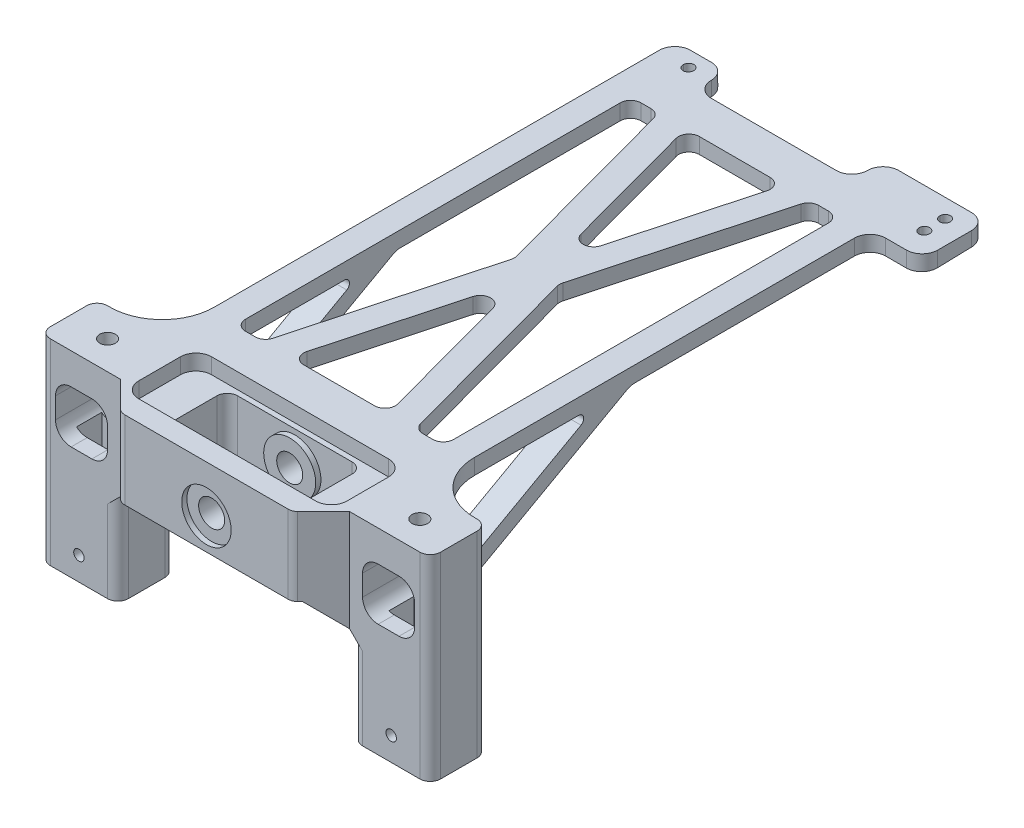
from build123d import *
from OCP.BRepAlgoAPI import BRepAlgoAPI_Cut
from OCP.TopTools import TopTools_ListOfShape

# Parameters (mm, degrees)
EXTRUDE_1_DEPTH        = 5.5
EXTRUDE_1_DEPTH_BACK   = 5.5
EXTRUDE_1_2_DEPTH      = 5.5
EXTRUDE_1_2_DEPTH_BACK = 5.5
SKETCH_2_W             = 7.050000000000001
SKETCH_2_H             = 4.83
CUT_EXTRUDE_1_DEPTH    = 62.00000000000001
SKETCH_3_W             = 26.000000000000004
SKETCH_3_H             = 12
EXTRUDE_2_DEPTH        = 12
SKETCH_4_R             = 2.5000000000000013
CUT_EXTRUDE_2_DEPTH    = 90
CHAMFER_2_SIZE         = 5
FILLET_2_R             = 2
SKETCH_14_W            = 15
SKETCH_14_H            = 11
EXTRUDE_5_DEPTH        = 10.25
SKETCH_7_R             = 0.9999999999999983
SKETCH_7_R_2           = 1.0000000000000018
CUT_EXTRUDE_3_DEPTH    = 34
EXTRUDE_START          = 1
SKETCH_13_R            = 5.0000000000000036
SKETCH_13_R_2          = 2.5000000000000013
EXTRUDE_4_DEPTH        = 1
CHAMFER_3_SIZE         = 5
CUT_EXTRUDE_4_DEPTH    = 31.2
SKETCH_17_R            = 4.75
SKETCH_17_R_2          = 2.5000000000000018
CUT_EXTRUDE_5_DEPTH    = 1
EXTRUDE_6_DEPTH        = 4.83
FILLET_6_R             = 3
FILLET_7_R             = 2
SKETCH_23_R            = 1.500000000000004
SKETCH_23_R_2          = 1.5000000000000007
CUT_EXTRUDE_6_DEPTH    = 3
EXTRUDE_START_2        = 3
SKETCH_24_R            = 1.499999999999997
SKETCH_24_W            = 39.99999999999999
SKETCH_24_H            = 14.000000000000002
SKETCH_24_R_2          = 1.500000000000004
SKETCH_24_R_3          = 1.0000000000000018
SKETCH_24_R_4          = 0.9999999999999983
EXTRUDE_7_DEPTH        = 3
FILLET_8_R             = 3
CUT_EXTRUDE_7_DEPTH    = 10
FILLET_10_R            = 10
FILLET_11_R            = 2
FILLET_12_R            = 3
CUT_EXTRUDE_8_DEPTH    = 67.00000000000001
SKETCH_31_RX           = 1.0003427924908692
SKETCH_31_RY           = 1.0000000000000009
SKETCH_31_RX_2         = 1.0003427924908834
CUT_EXTRUDE_9_DEPTH    = 67.00000000000001
EXTRUDE_11_REACH       = 117.887
CUT_EXTRUDE_11_DEPTH   = 15.000000000000004
FILLET_13_R            = 1
CUT_EXTRUDE_12_REACH   = 125.404
FILLET_14_R            = 3
EXTRUDE_12_REACH       = 117.887
SKETCH_38_W            = 4.999999999999954
SKETCH_38_H            = 40
CUT_EXTRUDE_13_DEPTH   = 15.000000000000004
FILLET_15_R            = 1
CUT_EXTRUDE_14_REACH   = 125.404
FILLET_16_R            = 3
FILLET_17_R            = 3
FILLET_18_R            = 1
SKETCH_41_W            = 30.000000000000004
SKETCH_41_H            = 6.000000000000028
CUT_EXTRUDE_15_DEPTH   = 3
FILLET_19_R            = 3


# Some blends are built 0.0001 mm under size
with BuildPart() as part:
    # 草图1 → 凸台-拉伸1 (new, two sides: drawn at the far end of the back side and taken through both)
    with BuildSketch(Plane.XY.offset(-EXTRUDE_1_DEPTH_BACK)):
        Polygon((22.5, -12.250000000000004), (37.5, -12.250000000000002), (37.5, 12.25), (22.5, 12.249999999999996), align=None)
    extrude(amount=EXTRUDE_1_DEPTH + EXTRUDE_1_DEPTH_BACK)


with BuildPart() as body_2:
    # 草图1 → Extrude 1 2 (new, two sides: drawn at the far end of the back side and taken through both)
    with BuildSketch(Plane.XY.offset(-EXTRUDE_1_2_DEPTH_BACK)):
        Polygon((-37.5, -12.250000000000002), (-37.5, 12.25), (-22.5, 12.249999999999996), (-22.5, -12.250000000000004), align=None)
    extrude(amount=EXTRUDE_1_2_DEPTH + EXTRUDE_1_2_DEPTH_BACK)


with BuildPart() as cut_extrude_1_tool:
    # 草图2 → 切除-拉伸1 (new body)
    with BuildSketch(Plane(origin=(-2.83e-15, 12.249999999999991, 0), x_dir=(1, -4.6e-16, 0), z_dir=(4.6e-16, 1, 0))):
        with Locations((30, 8.9e-16)):
            Rectangle(SKETCH_2_W, SKETCH_2_H)
        with Locations((-30, 8.9e-16)):
            Rectangle(SKETCH_2_W, SKETCH_2_H)
    extrude(amount=-CUT_EXTRUDE_1_DEPTH)


with BuildPart() as part_1:
    add(part.part)

    # 切除-拉伸1: cut by cut_extrude_1_tool
    add(cut_extrude_1_tool.part, mode=Mode.SUBTRACT)



with BuildPart() as body_2_1:
    add(body_2.part)

    # 切除-拉伸1: cut by cut_extrude_1_tool
    add(cut_extrude_1_tool.part, mode=Mode.SUBTRACT)


with BuildPart() as part_2:
    add(part_1.part)

    add(body_2_1.part)  # 凸台-拉伸2 merges body 2
    # 草图3 → 凸台-拉伸2 (add)
    with BuildSketch(Plane(origin=(2.83e-15, 12.249999999999991, 0), x_dir=(1, -2.3e-16, 0), z_dir=(2.3e-16, 1, 0))):
        Polygon((22.500000000000004, 5.5), (17, 5.499999999999999), (17, 11), (-17, 11), (-17, 5.499999999999999), (-22.500000000000004, 5.5), (-22.500000000000004, -5.5), (-17, -5.499999999999999), (-17, -11), (17, -11), (17, -5.499999999999999), (22.500000000000004, -5.5), align=None)
        Rectangle(SKETCH_3_W, SKETCH_3_H, mode=Mode.SUBTRACT)
    extrude(amount=-EXTRUDE_2_DEPTH)

    # 草图4 → 切除-拉伸2 (cut)
    with BuildSketch(Plane.XY.offset(11)):
        with Locations((0, 6.249999999999996)):
            Circle(SKETCH_4_R)
    extrude(amount=-CUT_EXTRUDE_2_DEPTH, mode=Mode.SUBTRACT)

    # 倒角2
    chamfer_2_edges = [part_2.edges().sort_by_distance(p)[0] for p in [
        (17.000000000000004, 6.249999999999988, 5.499999999999999),
        (-16.999999999999996, 6.249999999999995, 5.499999999999999),
        (-16.999999999999996, 6.249999999999995, -5.499999999999999),
        (17.000000000000004, 6.249999999999988, -5.499999999999999),
    ]]
    chamfer(chamfer_2_edges, length=CHAMFER_2_SIZE)

    # 圆角2
    # the kernel refuses this fillet: 2 mm, written as the material it adds along each edge
    with BuildSketch(Plane(origin=(-12.999999999999996, 12.249999999999995, 6), x_dir=(0, 0, -1), z_dir=(-2.3e-16, -1, 0)), Plane(origin=(13.000000000000004, 12.249999999999988, -6), x_dir=(0, 0, 1), z_dir=(-2.3e-16, -1, 0))) as fillet_2_piece_1:
        with BuildLine():
            CenterArc((FILLET_2_R, FILLET_2_R), FILLET_2_R, 180, 90)
            Line((0, FILLET_2_R), (0, 0))
            Line((0, 0), (FILLET_2_R, 0))
        make_face()
    extrude(amount=12)
    with BuildSketch(Plane(origin=(13.000000000000004, 12.249999999999988, 6), x_dir=(-1, 2.3e-16, 0), z_dir=(-2.3e-16, -1, 0))) as fillet_2_piece_2:
        with BuildLine():
            CenterArc((FILLET_2_R, FILLET_2_R), FILLET_2_R, 180, 90)
            Line((0, FILLET_2_R), (0, 0))
            Line((0, 0), (FILLET_2_R, 0))
        make_face()
    extrude(amount=12)
    with BuildSketch(Plane(origin=(-12.999999999999996, 12.249999999999995, -6), x_dir=(0, 0, 1), z_dir=(-2.3e-16, -1, 0))) as fillet_2_piece_3:
        with BuildLine():
            CenterArc((FILLET_2_R, -FILLET_2_R), FILLET_2_R, 90, 90)
            Line((0, -FILLET_2_R), (0, 0))
            Line((0, 0), (FILLET_2_R, 0))
        make_face()
    extrude(amount=12)
    # the kernel refuses this fillet: 2 mm, written as the material it takes off along each edge
    with BuildSketch(Plane(origin=(17.000000000000004, 15.557189138830744, 11), x_dir=(-7.11e-15, 0, -1), z_dir=(-2.3e-16, -1, 0))) as fillet_2_2_piece_1:
        with BuildLine():
            CenterArc((2.0000000000000093, -1.3228756555322878), FILLET_2_R, 138.59037789072946, 41.40962210927091)
            Line((9.4e-15, -1.322875655532302), (0, 0))
            Line((0, 0), (0.5000000000000018, 0))
        make_face()
    extrude(amount=18.61437827766151, mode=Mode.SUBTRACT)
    with BuildSketch(Plane(origin=(-16.999999999999996, 15.557189138830733, 11), x_dir=(1, -2.3e-16, 0), z_dir=(-2.3e-16, -1, 0))) as fillet_2_2_piece_2:
        with BuildLine():
            CenterArc((1.322875655532295, -2), FILLET_2_R, 90, 41.409622109270856)
            Line((0, -0.5), (0, 0))
            Line((0, 0), (1.322875655532295, 0))
        make_face()
    extrude(amount=18.614378277661476, mode=Mode.SUBTRACT)
    with BuildSketch(Plane(origin=(-16.999999999999996, 15.55718913883074, -11), x_dir=(1, -2.3e-16, 0), z_dir=(-2.3e-16, -1, 0))) as fillet_2_2_piece_3:
        with BuildLine():
            CenterArc((1.3228756555322985, 2), FILLET_2_R, 228.59037789072903, 41.40962210927097)
            Line((0, 0.5000000000000018), (0, 0))
            Line((0, 0), (1.3228756555322985, 0))
        make_face()
    extrude(amount=18.614378277661494, mode=Mode.SUBTRACT)
    with BuildSketch(Plane(origin=(17.000000000000004, 15.557189138830738, -11), x_dir=(-7.11e-15, 0, 1), z_dir=(-2.3e-16, -1, 0))) as fillet_2_2_piece_4:
        with BuildLine():
            CenterArc((2.0000000000000093, 1.322875655532286), FILLET_2_R, 179.9999999999996, 41.40962210927091)
            Line((9.4e-15, 1.3228756555323002), (0, 0))
            Line((0, 0), (0.5, 0))
        make_face()
    extrude(amount=18.6143782776615, mode=Mode.SUBTRACT)

    # 草图14 → 凸台-拉伸5 (add)
    # profile 1 of 2: a face of its own
    with BuildSketch(Plane.XZ.offset(12.250000000000007)):
        with Locations((-30, 0)):
            Rectangle(SKETCH_14_W, SKETCH_14_H)
        Polygon((-26.47500000000001, -2.415000000000001), (-26.47500000000001, 2.414999999999999), (-33.52500000000001, 2.414999999999999), (-33.52500000000003, -2.415000000000001), align=None, mode=Mode.SUBTRACT)
    # profile 2 of 2: a face of its own
    with BuildSketch(Plane.XZ.offset(12.250000000000007)):
        with Locations((30, 0)):
            Rectangle(SKETCH_14_W, SKETCH_14_H)
        Polygon((26.47499999999998, 2.414999999999999), (26.474999999999962, -2.415000000000001), (33.52499999999999, -2.415000000000001), (33.52499999999999, 2.414999999999999), align=None, mode=Mode.SUBTRACT)
    extrude(amount=EXTRUDE_5_DEPTH)

    # 草图7 → 切除-拉伸3 (cut)
    with BuildSketch(Plane.XY.offset(5.4999999999999964)):
        with Locations(Location((30, -18, 0), (0, 0, 180))):
            Circle(SKETCH_7_R)
        with Locations(Location((-30, -18, 0), (0, 0, 180))):
            Circle(SKETCH_7_R_2)
    extrude(amount=-CUT_EXTRUDE_3_DEPTH, mode=Mode.SUBTRACT)

    # 草图13 → 凸台-拉伸4 (add)
    with BuildSketch(Plane.XY.offset(-6).offset(EXTRUDE_START)):
        with Locations(Location((0, 6.249999999999996, 0), (0, 0, 180))):
            Circle(SKETCH_13_R)
        with Locations((0, 6.249999999999996)):
            Circle(SKETCH_13_R_2, mode=Mode.SUBTRACT)
    extrude_4 = extrude(amount=-EXTRUDE_4_DEPTH)

    # 镜向1: 凸台-拉伸4 across plane
    add(extrude_4.mirror(Plane.XY))

    # 倒角3
    chamfer_3_edges = [part_2.edges().sort_by_distance(p)[0] for p in [
        (22.500000000000004, 0.2499999999999859, 0),
        (-22.500000000000004, 0.24999999999999634, 0),
    ]]
    chamfer(chamfer_3_edges, length=CHAMFER_3_SIZE)

    # 草图19 → 切除-拉伸4 (cut)
    with BuildSketch(Plane.XY.offset(5.4999999999999964)):
        Polygon((-34.49999999999999, -0.7499999999999989), (-24.499999999999993, -0.7499999999999989), (-24.499999999999993, 9.25), (-34.49999999999999, 9.250000000000002), align=None)
        Polygon((34.49999999999999, 9.250000000000002), (24.499999999999993, 9.25), (24.499999999999993, -0.7499999999999989), (34.49999999999999, -0.7499999999999989), align=None)
    extrude(amount=-CUT_EXTRUDE_4_DEPTH, mode=Mode.SUBTRACT)

    # 草图17 → 切除-拉伸5 (cut)
    with BuildSketch(Plane.XY.offset(11)):
        with Locations((0, 6.249999999999996)):
            Circle(SKETCH_17_R)
        with Locations((0, 6.249999999999996)):
            Circle(SKETCH_17_R_2, mode=Mode.SUBTRACT)
    cut_extrude_5 = extrude(amount=-CUT_EXTRUDE_5_DEPTH, mode=Mode.SUBTRACT)

    # 镜向2: 切除-拉伸5 across plane
    add(cut_extrude_5.mirror(Plane.XY), mode=Mode.SUBTRACT)

    # 草图20 → 凸台-拉伸6 (add)
    with BuildSketch(Plane.XY.offset(-2.415000000000001)):
        Polygon((-33.525, 12.250000000000007), (-33.52500000000003, 9.250000000000004), (-26.474999999999998, 9.250000000000002), (-26.474999999999998, 12.249999999999998), align=None)
        Polygon((33.525, 9.250000000000002), (33.525, 12.249999999999998), (26.47499999999999, 12.24999999999998), (26.474999999999962, 9.250000000000002), align=None)
    extrude(amount=EXTRUDE_6_DEPTH)

    # 圆角6
    # the kernel refuses this fillet: 3 mm, written as the material it adds along each edge
    with BuildSketch(Plane(origin=(24.499999999999993, -0.7499999999999989, 5.4999999999999964), x_dir=(0, 1, 0), z_dir=(0, 0, -1))) as fillet_6_piece_1_section:
        with BuildLine():
            CenterArc((FILLET_6_R, FILLET_6_R), FILLET_6_R, 180, 90)
            Line((-2.2e-16, FILLET_6_R), (0, 0))
            Line((0, 0), (FILLET_6_R, 0))
        make_face()
    fillet_6_piece_1 = extrude(amount=10.999999999999996, mode=Mode.PRIVATE)
    fillet_6_piece_1 = split(fillet_6_piece_1, bisect_by=Plane(origin=(24.499999999999993, -0.7499999999999989, 2.414999999999999), z_dir=(0, 0, 1)), keep=Keep.TOP, mode=Mode.PRIVATE)
    fillet_6_piece_1 = split(fillet_6_piece_1, bisect_by=Plane(origin=(26.474999999999984, -0.7499999999999998, 5.4999999999999964), z_dir=(-1, 4.6e-16, 0)), keep=Keep.TOP, mode=Mode.PRIVATE)
    add(fillet_6_piece_1)
    with BuildSketch(Plane(origin=(24.499999999999993, -0.7499999999999989, 5.4999999999999964), x_dir=(0, 1, 0), z_dir=(0, 0, -1))) as fillet_6_piece_2_section:
        with BuildLine():
            CenterArc((FILLET_6_R, FILLET_6_R), FILLET_6_R, 180, 90)
            Line((-2.2e-16, FILLET_6_R), (0, 0))
            Line((0, 0), (FILLET_6_R, 0))
        make_face()
    fillet_6_piece_2 = extrude(amount=10.999999999999996, mode=Mode.PRIVATE)
    fillet_6_piece_2 = split(fillet_6_piece_2, bisect_by=Plane(origin=(24.499999999999993, -0.7499999999999989, 2.414999999999999), z_dir=(0, 0, 1)), keep=Keep.TOP, mode=Mode.PRIVATE)
    fillet_6_piece_2 = split(fillet_6_piece_2, bisect_by=Plane(origin=(26.474999999999984, -0.7499999999999998, 5.4999999999999964), z_dir=(1, -4.6e-16, 0)), keep=Keep.TOP, mode=Mode.PRIVATE)
    add(fillet_6_piece_2)
    with BuildSketch(Plane(origin=(24.499999999999993, -0.7499999999999989, 5.4999999999999964), x_dir=(0, 1, 0), z_dir=(0, 0, -1))) as fillet_6_piece_3_section:
        with BuildLine():
            CenterArc((FILLET_6_R, FILLET_6_R), FILLET_6_R, 180, 90)
            Line((-2.2e-16, FILLET_6_R), (0, 0))
            Line((0, 0), (FILLET_6_R, 0))
        make_face()
    fillet_6_piece_3 = extrude(amount=10.999999999999996, mode=Mode.PRIVATE)
    fillet_6_piece_3 = split(fillet_6_piece_3, bisect_by=Plane(origin=(24.499999999999993, -0.7499999999999989, -2.415000000000001), z_dir=(0, 0, 1)), keep=Keep.TOP, mode=Mode.PRIVATE)
    fillet_6_piece_3 = split(fillet_6_piece_3, bisect_by=Plane(origin=(24.499999999999993, -0.7499999999999989, 2.414999999999999), z_dir=(0, 0, -1)), keep=Keep.TOP, mode=Mode.PRIVATE)
    fillet_6_piece_3 = split(fillet_6_piece_3, bisect_by=Plane(origin=(26.474999999999984, -0.7499999999999998, 5.4999999999999964), z_dir=(-1, 4.6e-16, 0)), keep=Keep.TOP, mode=Mode.PRIVATE)
    add(fillet_6_piece_3)
    with BuildSketch(Plane(origin=(24.499999999999993, -0.7499999999999989, 5.4999999999999964), x_dir=(0, 1, 0), z_dir=(0, 0, -1))) as fillet_6_piece_4_section:
        with BuildLine():
            CenterArc((FILLET_6_R, FILLET_6_R), FILLET_6_R, 180, 90)
            Line((-2.2e-16, FILLET_6_R), (0, 0))
            Line((0, 0), (FILLET_6_R, 0))
        make_face()
    fillet_6_piece_4 = extrude(amount=10.999999999999996, mode=Mode.PRIVATE)
    fillet_6_piece_4 = split(fillet_6_piece_4, bisect_by=Plane(origin=(24.499999999999993, -0.7499999999999989, -2.415000000000001), z_dir=(0, 0, -1)), keep=Keep.TOP, mode=Mode.PRIVATE)
    fillet_6_piece_4 = split(fillet_6_piece_4, bisect_by=Plane(origin=(26.474999999999984, -0.7499999999999998, 5.4999999999999964), z_dir=(-1, 4.6e-16, 0)), keep=Keep.TOP, mode=Mode.PRIVATE)
    add(fillet_6_piece_4)
    with BuildSketch(Plane(origin=(24.499999999999993, -0.7499999999999989, 5.4999999999999964), x_dir=(0, 1, 0), z_dir=(0, 0, -1))) as fillet_6_piece_5_section:
        with BuildLine():
            CenterArc((FILLET_6_R, FILLET_6_R), FILLET_6_R, 180, 90)
            Line((-2.2e-16, FILLET_6_R), (0, 0))
            Line((0, 0), (FILLET_6_R, 0))
        make_face()
    fillet_6_piece_5 = extrude(amount=10.999999999999996, mode=Mode.PRIVATE)
    fillet_6_piece_5 = split(fillet_6_piece_5, bisect_by=Plane(origin=(24.499999999999993, -0.7499999999999989, -2.415000000000001), z_dir=(0, 0, -1)), keep=Keep.TOP, mode=Mode.PRIVATE)
    fillet_6_piece_5 = split(fillet_6_piece_5, bisect_by=Plane(origin=(26.474999999999984, -0.7499999999999998, 5.4999999999999964), z_dir=(1, -4.6e-16, 0)), keep=Keep.TOP, mode=Mode.PRIVATE)
    add(fillet_6_piece_5)
    with BuildSketch(Plane(origin=(-24.499999999999993, -0.7499999999999989, 5.4999999999999964), x_dir=(-1, -7e-17, 0), z_dir=(0, 0, -1))) as fillet_6_piece_6_section:
        with BuildLine():
            CenterArc((FILLET_6_R, FILLET_6_R), FILLET_6_R, 180, 90)
            Line((-2.2e-16, FILLET_6_R), (0, 0))
            Line((0, 0), (FILLET_6_R, 0))
        make_face()
    fillet_6_piece_6 = extrude(amount=10.999999999999996, mode=Mode.PRIVATE)
    fillet_6_piece_6 = split(fillet_6_piece_6, bisect_by=Plane(origin=(-24.499999999999993, -0.7499999999999989, 2.414999999999999), z_dir=(0, 0, 1)), keep=Keep.TOP, mode=Mode.PRIVATE)
    fillet_6_piece_6 = split(fillet_6_piece_6, bisect_by=Plane(origin=(-26.475000000000005, -0.749999999999998, 5.4999999999999964), z_dir=(-1, 4.6e-16, 0)), keep=Keep.TOP, mode=Mode.PRIVATE)
    add(fillet_6_piece_6)
    with BuildSketch(Plane(origin=(-24.499999999999993, -0.7499999999999989, 5.4999999999999964), x_dir=(-1, -7e-17, 0), z_dir=(0, 0, -1))) as fillet_6_piece_7_section:
        with BuildLine():
            CenterArc((FILLET_6_R, FILLET_6_R), FILLET_6_R, 180, 90)
            Line((-2.2e-16, FILLET_6_R), (0, 0))
            Line((0, 0), (FILLET_6_R, 0))
        make_face()
    fillet_6_piece_7 = extrude(amount=10.999999999999996, mode=Mode.PRIVATE)
    fillet_6_piece_7 = split(fillet_6_piece_7, bisect_by=Plane(origin=(-24.499999999999993, -0.7499999999999989, 2.414999999999999), z_dir=(0, 0, 1)), keep=Keep.TOP, mode=Mode.PRIVATE)
    fillet_6_piece_7 = split(fillet_6_piece_7, bisect_by=Plane(origin=(-26.475000000000005, -0.749999999999998, 5.4999999999999964), z_dir=(1, -4.6e-16, 0)), keep=Keep.TOP, mode=Mode.PRIVATE)
    add(fillet_6_piece_7)
    with BuildSketch(Plane(origin=(-24.499999999999993, -0.7499999999999989, 5.4999999999999964), x_dir=(-1, -7e-17, 0), z_dir=(0, 0, -1))) as fillet_6_piece_8_section:
        with BuildLine():
            CenterArc((FILLET_6_R, FILLET_6_R), FILLET_6_R, 180, 90)
            Line((-2.2e-16, FILLET_6_R), (0, 0))
            Line((0, 0), (FILLET_6_R, 0))
        make_face()
    fillet_6_piece_8 = extrude(amount=10.999999999999996, mode=Mode.PRIVATE)
    fillet_6_piece_8 = split(fillet_6_piece_8, bisect_by=Plane(origin=(-24.499999999999993, -0.7499999999999989, 2.414999999999999), z_dir=(0, 0, -1)), keep=Keep.TOP, mode=Mode.PRIVATE)
    fillet_6_piece_8 = split(fillet_6_piece_8, bisect_by=Plane(origin=(-24.499999999999993, -0.7499999999999989, -2.415000000000001), z_dir=(0, 0, 1)), keep=Keep.TOP, mode=Mode.PRIVATE)
    fillet_6_piece_8 = split(fillet_6_piece_8, bisect_by=Plane(origin=(-26.475000000000005, -0.749999999999998, 5.4999999999999964), z_dir=(1, -4.6e-16, 0)), keep=Keep.TOP, mode=Mode.PRIVATE)
    add(fillet_6_piece_8)
    with BuildSketch(Plane(origin=(-24.499999999999993, -0.7499999999999989, 5.4999999999999964), x_dir=(-1, -7e-17, 0), z_dir=(0, 0, -1))) as fillet_6_piece_9_section:
        with BuildLine():
            CenterArc((FILLET_6_R, FILLET_6_R), FILLET_6_R, 180, 90)
            Line((-2.2e-16, FILLET_6_R), (0, 0))
            Line((0, 0), (FILLET_6_R, 0))
        make_face()
    fillet_6_piece_9 = extrude(amount=10.999999999999996, mode=Mode.PRIVATE)
    fillet_6_piece_9 = split(fillet_6_piece_9, bisect_by=Plane(origin=(-24.499999999999993, -0.7499999999999989, -2.415000000000001), z_dir=(0, 0, -1)), keep=Keep.TOP, mode=Mode.PRIVATE)
    fillet_6_piece_9 = split(fillet_6_piece_9, bisect_by=Plane(origin=(-26.475000000000005, -0.749999999999998, 5.4999999999999964), z_dir=(-1, 4.6e-16, 0)), keep=Keep.TOP, mode=Mode.PRIVATE)
    add(fillet_6_piece_9)
    with BuildSketch(Plane(origin=(-24.499999999999993, -0.7499999999999989, 5.4999999999999964), x_dir=(-1, -7e-17, 0), z_dir=(0, 0, -1))) as fillet_6_piece_10_section:
        with BuildLine():
            CenterArc((FILLET_6_R, FILLET_6_R), FILLET_6_R, 180, 90)
            Line((-2.2e-16, FILLET_6_R), (0, 0))
            Line((0, 0), (FILLET_6_R, 0))
        make_face()
    fillet_6_piece_10 = extrude(amount=10.999999999999996, mode=Mode.PRIVATE)
    fillet_6_piece_10 = split(fillet_6_piece_10, bisect_by=Plane(origin=(-24.499999999999993, -0.7499999999999989, -2.415000000000001), z_dir=(0, 0, -1)), keep=Keep.TOP, mode=Mode.PRIVATE)
    fillet_6_piece_10 = split(fillet_6_piece_10, bisect_by=Plane(origin=(-26.475000000000005, -0.749999999999998, 5.4999999999999964), z_dir=(1, -4.6e-16, 0)), keep=Keep.TOP, mode=Mode.PRIVATE)
    add(fillet_6_piece_10)
    with BuildSketch(Plane(origin=(34.49999999999999, -0.7499999999999989, 5.4999999999999964), x_dir=(-1, -7e-17, 0), z_dir=(0, 0, -1))) as fillet_6_piece_11_section:
        with BuildLine():
            CenterArc((FILLET_6_R, FILLET_6_R), FILLET_6_R, 180, 90)
            Line((-2.2e-16, FILLET_6_R), (0, 0))
            Line((0, 0), (FILLET_6_R, 0))
        make_face()
    fillet_6_piece_11 = extrude(amount=10.999999999999996, mode=Mode.PRIVATE)
    fillet_6_piece_11 = split(fillet_6_piece_11, bisect_by=Plane(origin=(33.52499999999999, -0.7499999999999984, 5.4999999999999964), z_dir=(-1, 4.6e-16, 0)), keep=Keep.TOP, mode=Mode.PRIVATE)
    fillet_6_piece_11 = split(fillet_6_piece_11, bisect_by=Plane(origin=(34.49999999999999, -0.7499999999999989, 2.414999999999999), z_dir=(0, 0, 1)), keep=Keep.TOP, mode=Mode.PRIVATE)
    add(fillet_6_piece_11)
    with BuildSketch(Plane(origin=(34.49999999999999, -0.7499999999999989, 5.4999999999999964), x_dir=(-1, -7e-17, 0), z_dir=(0, 0, -1))) as fillet_6_piece_12_section:
        with BuildLine():
            CenterArc((FILLET_6_R, FILLET_6_R), FILLET_6_R, 180, 90)
            Line((-2.2e-16, FILLET_6_R), (0, 0))
            Line((0, 0), (FILLET_6_R, 0))
        make_face()
    fillet_6_piece_12 = extrude(amount=10.999999999999996, mode=Mode.PRIVATE)
    fillet_6_piece_12 = split(fillet_6_piece_12, bisect_by=Plane(origin=(33.52499999999999, -0.7499999999999984, 5.4999999999999964), z_dir=(1, -4.6e-16, 0)), keep=Keep.TOP, mode=Mode.PRIVATE)
    fillet_6_piece_12 = split(fillet_6_piece_12, bisect_by=Plane(origin=(34.49999999999999, -0.7499999999999989, 2.414999999999999), z_dir=(0, 0, 1)), keep=Keep.TOP, mode=Mode.PRIVATE)
    add(fillet_6_piece_12)
    with BuildSketch(Plane(origin=(34.49999999999999, -0.7499999999999989, 5.4999999999999964), x_dir=(-1, -7e-17, 0), z_dir=(0, 0, -1))) as fillet_6_piece_13_section:
        with BuildLine():
            CenterArc((FILLET_6_R, FILLET_6_R), FILLET_6_R, 180, 90)
            Line((-2.2e-16, FILLET_6_R), (0, 0))
            Line((0, 0), (FILLET_6_R, 0))
        make_face()
    fillet_6_piece_13 = extrude(amount=10.999999999999996, mode=Mode.PRIVATE)
    fillet_6_piece_13 = split(fillet_6_piece_13, bisect_by=Plane(origin=(34.49999999999999, -0.7499999999999989, -2.415000000000001), z_dir=(0, 0, 1)), keep=Keep.TOP, mode=Mode.PRIVATE)
    fillet_6_piece_13 = split(fillet_6_piece_13, bisect_by=Plane(origin=(33.52499999999999, -0.7499999999999984, 5.4999999999999964), z_dir=(1, -4.6e-16, 0)), keep=Keep.TOP, mode=Mode.PRIVATE)
    fillet_6_piece_13 = split(fillet_6_piece_13, bisect_by=Plane(origin=(34.49999999999999, -0.7499999999999989, 2.414999999999999), z_dir=(0, 0, -1)), keep=Keep.TOP, mode=Mode.PRIVATE)
    add(fillet_6_piece_13)
    with BuildSketch(Plane(origin=(34.49999999999999, -0.7499999999999989, 5.4999999999999964), x_dir=(-1, -7e-17, 0), z_dir=(0, 0, -1))) as fillet_6_piece_14_section:
        with BuildLine():
            CenterArc((FILLET_6_R, FILLET_6_R), FILLET_6_R, 180, 90)
            Line((-2.2e-16, FILLET_6_R), (0, 0))
            Line((0, 0), (FILLET_6_R, 0))
        make_face()
    fillet_6_piece_14 = extrude(amount=10.999999999999996, mode=Mode.PRIVATE)
    fillet_6_piece_14 = split(fillet_6_piece_14, bisect_by=Plane(origin=(34.49999999999999, -0.7499999999999989, -2.415000000000001), z_dir=(0, 0, -1)), keep=Keep.TOP, mode=Mode.PRIVATE)
    fillet_6_piece_14 = split(fillet_6_piece_14, bisect_by=Plane(origin=(33.52499999999999, -0.7499999999999984, 5.4999999999999964), z_dir=(-1, 4.6e-16, 0)), keep=Keep.TOP, mode=Mode.PRIVATE)
    add(fillet_6_piece_14)
    with BuildSketch(Plane(origin=(34.49999999999999, -0.7499999999999989, 5.4999999999999964), x_dir=(-1, -7e-17, 0), z_dir=(0, 0, -1))) as fillet_6_piece_15_section:
        with BuildLine():
            CenterArc((FILLET_6_R, FILLET_6_R), FILLET_6_R, 180, 90)
            Line((-2.2e-16, FILLET_6_R), (0, 0))
            Line((0, 0), (FILLET_6_R, 0))
        make_face()
    fillet_6_piece_15 = extrude(amount=10.999999999999996, mode=Mode.PRIVATE)
    fillet_6_piece_15 = split(fillet_6_piece_15, bisect_by=Plane(origin=(34.49999999999999, -0.7499999999999989, -2.415000000000001), z_dir=(0, 0, -1)), keep=Keep.TOP, mode=Mode.PRIVATE)
    fillet_6_piece_15 = split(fillet_6_piece_15, bisect_by=Plane(origin=(33.52499999999999, -0.7499999999999984, 5.4999999999999964), z_dir=(1, -4.6e-16, 0)), keep=Keep.TOP, mode=Mode.PRIVATE)
    add(fillet_6_piece_15)
    with BuildSketch(Plane(origin=(24.499999999999993, 9.25, 5.4999999999999964), x_dir=(1, 0, 0), z_dir=(0, 0, -1))) as fillet_6_piece_16:
        with BuildLine():
            CenterArc((FILLET_6_R, FILLET_6_R), FILLET_6_R, 180, 90)
            Line((0, FILLET_6_R), (0, 0))
            Line((0, 0), (FILLET_6_R, 0))
        make_face()
    extrude(amount=10.999999999999996)
    with BuildSketch(Plane(origin=(34.49999999999999, 9.250000000000002, 5.4999999999999964), x_dir=(-1, 0, 0), z_dir=(0, 0, -1))) as fillet_6_piece_17:
        with BuildLine():
            CenterArc((FILLET_6_R, -FILLET_6_R), FILLET_6_R, 90, 90)
            Line((0, -FILLET_6_R), (0, 0))
            Line((0, 0), (FILLET_6_R, 0))
        make_face()
    extrude(amount=10.999999999999996)
    with BuildSketch(Plane(origin=(-24.499999999999993, 9.25, 5.4999999999999964), x_dir=(0, -1, 0), z_dir=(0, 0, -1))) as fillet_6_piece_18:
        with BuildLine():
            CenterArc((FILLET_6_R, FILLET_6_R), FILLET_6_R, 180, 90)
            Line((0, FILLET_6_R), (0, 0))
            Line((0, 0), (FILLET_6_R, 0))
        make_face()
    extrude(amount=10.999999999999996)
    with BuildSketch(Plane(origin=(-34.49999999999999, 9.250000000000002, 5.4999999999999964), x_dir=(1, 0, 0), z_dir=(0, 0, -1))) as fillet_6_piece_19:
        with BuildLine():
            CenterArc((FILLET_6_R, FILLET_6_R), FILLET_6_R, 180, 90)
            Line((0, FILLET_6_R), (0, 0))
            Line((0, 0), (FILLET_6_R, 0))
        make_face()
    extrude(amount=10.999999999999998)
    with BuildSketch(Plane(origin=(-34.49999999999999, -0.7499999999999989, 5.4999999999999964), x_dir=(1, -7e-17, 0), z_dir=(0, 0, -1))) as fillet_6_piece_20_section:
        with BuildLine():
            CenterArc((FILLET_6_R, -FILLET_6_R), FILLET_6_R, 90, 90)
            Line((-2.2e-16, -FILLET_6_R), (0, 0))
            Line((0, 0), (FILLET_6_R, 0))
        make_face()
    fillet_6_piece_20 = extrude(amount=10.999999999999998, mode=Mode.PRIVATE)
    fillet_6_piece_20 = split(fillet_6_piece_20, bisect_by=Plane(origin=(-34.49999999999999, -0.7499999999999989, 2.414999999999999), z_dir=(0, 0, 1)), keep=Keep.TOP, mode=Mode.PRIVATE)
    fillet_6_piece_20 = split(fillet_6_piece_20, bisect_by=Plane(origin=(-33.525000000000006, -0.7499999999999993, 5.4999999999999964), z_dir=(1, -4.6e-16, 0)), keep=Keep.TOP, mode=Mode.PRIVATE)
    add(fillet_6_piece_20)
    with BuildSketch(Plane(origin=(-34.49999999999999, -0.7499999999999989, 5.4999999999999964), x_dir=(1, -7e-17, 0), z_dir=(0, 0, -1))) as fillet_6_piece_21_section:
        with BuildLine():
            CenterArc((FILLET_6_R, -FILLET_6_R), FILLET_6_R, 90, 90)
            Line((-2.2e-16, -FILLET_6_R), (0, 0))
            Line((0, 0), (FILLET_6_R, 0))
        make_face()
    fillet_6_piece_21 = extrude(amount=10.999999999999998, mode=Mode.PRIVATE)
    fillet_6_piece_21 = split(fillet_6_piece_21, bisect_by=Plane(origin=(-34.49999999999999, -0.7499999999999989, 2.414999999999999), z_dir=(0, 0, 1)), keep=Keep.TOP, mode=Mode.PRIVATE)
    fillet_6_piece_21 = split(fillet_6_piece_21, bisect_by=Plane(origin=(-33.525000000000006, -0.7499999999999993, 5.4999999999999964), z_dir=(-1, 4.6e-16, 0)), keep=Keep.TOP, mode=Mode.PRIVATE)
    add(fillet_6_piece_21)
    with BuildSketch(Plane(origin=(-34.49999999999999, -0.7499999999999989, 5.4999999999999964), x_dir=(1, -7e-17, 0), z_dir=(0, 0, -1))) as fillet_6_piece_22_section:
        with BuildLine():
            CenterArc((FILLET_6_R, -FILLET_6_R), FILLET_6_R, 90, 90)
            Line((-2.2e-16, -FILLET_6_R), (0, 0))
            Line((0, 0), (FILLET_6_R, 0))
        make_face()
    fillet_6_piece_22 = extrude(amount=10.999999999999998, mode=Mode.PRIVATE)
    fillet_6_piece_22 = split(fillet_6_piece_22, bisect_by=Plane(origin=(-34.49999999999999, -0.7499999999999989, 2.414999999999999), z_dir=(0, 0, -1)), keep=Keep.TOP, mode=Mode.PRIVATE)
    fillet_6_piece_22 = split(fillet_6_piece_22, bisect_by=Plane(origin=(-33.525000000000006, -0.7499999999999993, 5.4999999999999964), z_dir=(-1, 4.6e-16, 0)), keep=Keep.TOP, mode=Mode.PRIVATE)
    fillet_6_piece_22 = split(fillet_6_piece_22, bisect_by=Plane(origin=(-34.49999999999999, -0.7499999999999989, -2.415000000000001), z_dir=(0, 0, 1)), keep=Keep.TOP, mode=Mode.PRIVATE)
    add(fillet_6_piece_22)
    with BuildSketch(Plane(origin=(-34.49999999999999, -0.7499999999999989, 5.4999999999999964), x_dir=(1, -7e-17, 0), z_dir=(0, 0, -1))) as fillet_6_piece_23_section:
        with BuildLine():
            CenterArc((FILLET_6_R, -FILLET_6_R), FILLET_6_R, 90, 90)
            Line((-2.2e-16, -FILLET_6_R), (0, 0))
            Line((0, 0), (FILLET_6_R, 0))
        make_face()
    fillet_6_piece_23 = extrude(amount=10.999999999999998, mode=Mode.PRIVATE)
    fillet_6_piece_23 = split(fillet_6_piece_23, bisect_by=Plane(origin=(-33.525000000000006, -0.7499999999999993, 5.4999999999999964), z_dir=(1, -4.6e-16, 0)), keep=Keep.TOP, mode=Mode.PRIVATE)
    fillet_6_piece_23 = split(fillet_6_piece_23, bisect_by=Plane(origin=(-34.49999999999999, -0.7499999999999989, -2.415000000000001), z_dir=(0, 0, -1)), keep=Keep.TOP, mode=Mode.PRIVATE)
    add(fillet_6_piece_23)
    with BuildSketch(Plane(origin=(-34.49999999999999, -0.7499999999999989, 5.4999999999999964), x_dir=(1, -7e-17, 0), z_dir=(0, 0, -1))) as fillet_6_piece_24_section:
        with BuildLine():
            CenterArc((FILLET_6_R, -FILLET_6_R), FILLET_6_R, 90, 90)
            Line((-2.2e-16, -FILLET_6_R), (0, 0))
            Line((0, 0), (FILLET_6_R, 0))
        make_face()
    fillet_6_piece_24 = extrude(amount=10.999999999999998, mode=Mode.PRIVATE)
    fillet_6_piece_24 = split(fillet_6_piece_24, bisect_by=Plane(origin=(-33.525000000000006, -0.7499999999999993, 5.4999999999999964), z_dir=(-1, 4.6e-16, 0)), keep=Keep.TOP, mode=Mode.PRIVATE)
    fillet_6_piece_24 = split(fillet_6_piece_24, bisect_by=Plane(origin=(-34.49999999999999, -0.7499999999999989, -2.415000000000001), z_dir=(0, 0, -1)), keep=Keep.TOP, mode=Mode.PRIVATE)
    add(fillet_6_piece_24)

    # 圆角7
    fillet_7_edges = [part_2.edges().sort_by_distance(p)[0] for p in [
        (-37.5, -5.125, -5.5),
        (-22.500000000000004, -13.625000000000002, 5.5),
        (-37.5, -5.125, 5.5),
        (37.5, -5.125000000000007, 5.5),
        (22.5, -13.625000000000005, 5.5),
        (22.5, -13.625000000000005, -5.5),
        (37.5, -5.125000000000007, -5.5),
        (-22.500000000000004, -13.625000000000002, -5.5),
    ]]
    fillet(fillet_7_edges, radius=FILLET_7_R)

    # 草图23 → 切除-拉伸6 (cut)
    with BuildSketch(Plane(origin=(-2.83e-15, 12.249999999999991, 0), x_dir=(1, 2.3e-16, 0), z_dir=(-2.3e-16, 1, 0))):
        with Locations(Location((30, 0, 0), (0, 0, 180))):
            Circle(SKETCH_23_R)
        with Locations(Location((-30, 0, 0), (0, 0, 180))):
            Circle(SKETCH_23_R_2)
    extrude(amount=-CUT_EXTRUDE_6_DEPTH, mode=Mode.SUBTRACT)

    # 草图24 → 凸台-拉伸7 (add)
    # profile 1 of 8: a face of its own
    with BuildSketch(Plane(origin=(-2.83e-15, 12.249999999999991, 0), x_dir=(1, 2.3e-16, 0), z_dir=(-2.3e-16, 1, 0)).offset(EXTRUDE_START_2)):
        with BuildLine():
            ThreePointArc((-16.999999999999993, -10.499999999999986), (-16.38423112565424, -10.870828693386965), (-15.677124344467684, -11))
            Line((-15.677124344467686, -11.00000000000001), (15.67712434446777, -11.00000000000001))
            ThreePointArc((15.677124344467767, -11), (16.38423112565428, -10.870828693386983), (17.000000000000007, -10.500000000000048))
            Line((17.000000000000007, -10.500000000000048), (22.000000000000007, -5.5))
            Line((22.000000000000007, -5.5), (34.99999999999995, -5.5))
            Line((34.99999999999995, -5.5), (34.99999999999995, 5.5))
            Line((34.99999999999995, 5.500000000000001), (22.00000000000004, 5.5))
            Line((22.00000000000004, 5.5), (17.000000000000007, 10.499999999999984))
            ThreePointArc((17.000000000000007, 10.499999999999984), (16.384231125654253, 10.870828693386969), (15.67712434446769, 11))
            Line((15.67712434446769, 11), (-15.677124344467737, 11))
            ThreePointArc((-15.677124344467739, 11), (-16.38423112565426, 10.87082869338698), (-16.999999999999993, 10.500000000000034))
            Line((-16.999999999999993, 10.500000000000034), (-21.999999999999986, 5.5))
            Line((-21.999999999999986, 5.5), (-35, 5.500000000000002))
            Line((-35, 5.5000000000000036), (-35, -5.500000000000003))
            Line((-35, -5.5000000000000036), (-22.000000000000025, -5.5))
            Line((-22.000000000000025, -5.5), (-16.999999999999993, -10.499999999999986))
        make_face()
        with Locations(Location((-30, 0, 0), (0, 0, 180))):
            Circle(SKETCH_24_R, mode=Mode.SUBTRACT)
        Rectangle(SKETCH_24_W, SKETCH_24_H, mode=Mode.SUBTRACT)
        with Locations(Location((30, 0, 0), (0, 0, 180))):
            Circle(SKETCH_24_R_2, mode=Mode.SUBTRACT)
    # profile 2 of 8: a face of its own
    with BuildSketch(Plane(origin=(-2.83e-15, 12.249999999999991, 0), x_dir=(1, 2.3e-16, 0), z_dir=(-2.3e-16, 1, 0)).offset(EXTRUDE_START_2)):
        with BuildLine():
            Line((-35.5, -5.5000000000000036), (-35, -5.5000000000000036))
            Line((-35, -5.500000000000003), (-35, 5.5000000000000036))
            Line((-35, 5.500000000000002), (-35.5, 5.500000000000002))
            ThreePointArc((-35.5, 5.5000000000000036), (-36.91421356237309, 4.914213562373096), (-37.5, 3.5000000000000018))
            Line((-37.5, 3.5000000000000018), (-37.5, -3.5000000000000018))
            ThreePointArc((-37.5, -3.5000000000000013), (-36.91421356237309, -4.914213562373096), (-35.5, -5.5000000000000036))
        make_face()
    # profile 3 of 8: a face of its own
    with BuildSketch(Plane(origin=(-2.83e-15, 12.249999999999991, 0), x_dir=(1, 2.3e-16, 0), z_dir=(-2.3e-16, 1, 0)).offset(EXTRUDE_START_2)):
        with BuildLine():
            Line((34.99999999999995, 5.5), (34.99999999999995, -5.5))
            Line((34.99999999999995, -5.5), (35.5, -5.5))
            ThreePointArc((35.5, -5.500000000000001), (36.91421356237309, -4.914213562373093), (37.5, -3.4999999999999996))
            Line((37.5, -3.4999999999999996), (37.5, 3.4999999999999996))
            ThreePointArc((37.5, 3.4999999999999996), (36.91421356237309, 4.914213562373093), (35.5, 5.5))
            Line((35.5, 5.500000000000001), (34.99999999999995, 5.500000000000001))
        make_face()
    # profile 4 of 8: a face of its own
    with BuildSketch(Plane(origin=(-2.83e-15, 12.249999999999991, 0), x_dir=(1, 2.3e-16, 0), z_dir=(-2.3e-16, 1, 0)).offset(EXTRUDE_START_2)):
        with BuildLine():
            Line((-35, 104), (-35, 5.5000000000000036))
            Line((-35, 5.500000000000002), (-21.999999999999986, 5.5))
            Line((-21.999999999999986, 5.5), (-16.999999999999993, 10.500000000000034))
            ThreePointArc((-16.999999999999993, 10.500000000000034), (-16.38423112565426, 10.87082869338698), (-15.677124344467739, 11))
            Line((-15.677124344467737, 11), (15.67712434446769, 11))
            ThreePointArc((15.67712434446769, 11), (16.384231125654253, 10.870828693386969), (17.000000000000007, 10.499999999999984))
            Line((17.000000000000007, 10.499999999999984), (22.00000000000004, 5.5))
            Line((22.00000000000004, 5.5), (34.99999999999995, 5.500000000000001))
            Line((34.99999999999995, 5.5), (34.99999999999995, 104))
            Line((34.99999999999994, 104), (-35, 104))
        make_face()
        Polygon((-14.590173461835422, 14.499999999999977), (-20.00000000000002, 14.499999999999975), (-20.00000000000002, 90.50000000000003), (-14.590173461835422, 90.50000000000003), (-9.410092836810021, 90.50000000000003), (9.410092836810023, 90.50000000000003), (14.59017346183542, 90.50000000000003), (19.99999999999997, 90.50000000000003), (19.99999999999998, 14.499999999999995), (14.59017346183542, 14.499999999999993), (9.410092836810023, 14.49999999999999), (-9.410092836810021, 14.49999999999998), align=None, mode=Mode.SUBTRACT)
        with Locations(Location((-19.30000000000005, 100.96, 0), (0, 0, 180))):
            Circle(SKETCH_24_R_3, mode=Mode.SUBTRACT)
        with Locations(Location((30.49999999999995, 96.46, 0), (0, 0, 180))):
            Circle(SKETCH_24_R_4, mode=Mode.SUBTRACT)
        with Locations(Location((30.49999999999995, 100.46, 0), (0, 0, 180))):
            Circle(SKETCH_24_R_4, mode=Mode.SUBTRACT)
    # profile 5 of 8: a face of its own
    with BuildSketch(Plane(origin=(-2.83e-15, 12.249999999999991, 0), x_dir=(1, 2.3e-16, 0), z_dir=(-2.3e-16, 1, 0)).offset(EXTRUDE_START_2)):
        Polygon((-14.59017346183542, 90.50000000000004), (-4.2999999999999945, 52.5), (-5.33e-15, 52.5), (-5.2e-15, 55.75), (-9.410092836810021, 90.50000000000003), align=None)
    # profile 6 of 8: a face of its own
    with BuildSketch(Plane(origin=(-2.83e-15, 12.249999999999991, 0), x_dir=(1, 2.3e-16, 0), z_dir=(-2.3e-16, 1, 0)).offset(EXTRUDE_START_2)):
        Polygon((-5.2e-15, 55.75), (-5.2e-15, 52.5), (4.2999999999999945, 52.5), (14.59017346183542, 90.50000000000003), (9.410092836810023, 90.50000000000003), align=None)
    # profile 7 of 8: a face of its own
    with BuildSketch(Plane(origin=(-2.83e-15, 12.249999999999991, 0), x_dir=(1, 2.3e-16, 0), z_dir=(-2.3e-16, 1, 0)).offset(EXTRUDE_START_2)):
        Polygon((-5.33e-15, 49.249999999999986), (9.410092836810021, 14.499999999999975), (14.59017346183542, 14.499999999999993), (4.2999999999999945, 52.5), (-5.2e-15, 52.5), align=None)
    # profile 8 of 8: a face of its own
    with BuildSketch(Plane(origin=(-2.83e-15, 12.249999999999991, 0), x_dir=(1, 2.3e-16, 0), z_dir=(-2.3e-16, 1, 0)).offset(EXTRUDE_START_2)):
        Polygon((-4.2999999999999945, 52.5), (-14.59017346183542, 14.499999999999972), (-9.410092836810021, 14.49999999999998), (-3.55e-15, 49.249999999999986), (-5.2e-15, 52.5), align=None)
    extrude(amount=-EXTRUDE_7_DEPTH)

    # 圆角8
    fillet_8_edges = [part_2.edges().sort_by_distance(p)[0] for p in [
        (19.99999999999999, 13.749999999999996, -7.000000000000003),
        (19.99999999999999, 13.749999999999996, 6.999999999999999),
        (-20.000000000000004, 13.749999999999986, 6.999999999999999),
        (-20.000000000000004, 13.749999999999986, -7.000000000000003),
    ]]
    fillet(fillet_8_edges, radius=FILLET_8_R)

    # 草图27 → 切除-拉伸7 (cut)
    with BuildSketch(Plane(origin=(-3.46e-15, 15.249999999999993, 0), x_dir=(1, 2.3e-16, 0), z_dir=(-2.3e-16, 1, 0))):
        Polygon((-24.999999999999982, 5.499999999999999), (-24.999999999999982, 91.5), (-34.99999999999995, 91.5), (-34.99999999999995, 5.5), align=None)
        Polygon((-24.999999999999982, 91.5), (-24.999999999999982, 104), (-35, 104), (-34.99999999999995, 91.5), align=None)
        Polygon((24.999999999999982, 5.499999999999999), (34.99999999999995, 5.5), (34.99999999999995, 91.5), (24.999999999999982, 91.5), align=None)
    extrude(amount=-CUT_EXTRUDE_7_DEPTH, mode=Mode.SUBTRACT)

    # 圆角10
    fillet_10_edges = [part_2.edges().sort_by_distance(p)[0] for p in [
        (-24.999999999999986, 13.749999999999993, -5.499999999999999),
        (24.99999999999998, 13.749999999999996, -5.499999999999999),
    ]]
    fillet(fillet_10_edges, radius=FILLET_10_R)

    # 圆角11
    fillet_11_edges = [part_2.edges().sort_by_distance(p)[0] for p in [
        (9.41009283681002, 13.749999999999993, -90.50000000000003),
        (-8.45e-15, 13.749999999999991, -55.75),
        (-14.590173461835423, 13.749999999999988, -90.50000000000003),
        (-4.299999999999998, 13.74999999999999, -52.5),
        (-14.590173461835423, 13.749999999999988, -14.499999999999975),
        (-20.000000000000025, 13.749999999999986, -14.499999999999975),
        (14.590173461835416, 13.749999999999995, -14.499999999999982),
        (4.299999999999991, 13.749999999999993, -52.5),
        (14.590173461835416, 13.749999999999995, -90.50000000000003),
        (19.999999999999968, 13.749999999999996, -90.50000000000003),
        (-9.410092836810025, 13.74999999999999, -14.499999999999979),
        (-8.45e-15, 13.749999999999991, -49.249999999999986),
        (-9.410092836810025, 13.74999999999999, -90.50000000000003),
        (-20.000000000000025, 13.749999999999986, -90.50000000000003),
        (19.999999999999975, 13.749999999999996, -14.499999999999995),
        (9.41009283681002, 13.749999999999993, -14.499999999999982),
    ]]
    fillet(fillet_11_edges, radius=FILLET_11_R)

    # 圆角12
    fillet_12_edges = [part_2.edges().sort_by_distance(p)[0] for p in [
        (34.99999999999994, 13.75, -104),
        (-24.999999999999986, 13.749999999999986, -104),
        (24.99999999999998, 13.749999999999996, -91.5),
        (34.99999999999995, 13.75, -91.5),
    ]]
    fillet(fillet_12_edges, radius=FILLET_12_R)

    # 草图30 → 切除-拉伸8 (cut)
    with BuildSketch(Plane(origin=(34.99999999999996, 8.1e-15, 0), x_dir=(0, 0, -1), z_dir=(1, 2.3e-16, 0))):
        Polygon((91.5, 12.249999999999991), (118.23192150792485, 12.94999999999999), (118.23192150792485, 12.249999999999991), align=None)
    extrude(amount=-CUT_EXTRUDE_8_DEPTH, mode=Mode.SUBTRACT)


with BuildPart() as cut_extrude_9_tool:
    # 草图31 → 切除-拉伸9 (new body)
    with BuildSketch(Plane(origin=(-2.28e-15, 9.847235902257708, 0.2578589470097349), x_dir=(1, 2.3e-16, 1e-17), z_dir=(0, -0.9996573249755576, -0.02617694830786635))):
        with Locations(Location((-19.30000000000005, -101.2525556689985), (0, 0, 90))):
            Ellipse(SKETCH_31_RX, SKETCH_31_RY)
        with Locations(Location((30.49999999999995, -100.75238427275306), (0, 0, 90))):
            Ellipse(SKETCH_31_RX_2, SKETCH_31_RY)
        with Locations(Location((30.49999999999995, -96.75101310278959), (0, 0, 90))):
            Ellipse(SKETCH_31_RX, SKETCH_31_RY)
    extrude(amount=-CUT_EXTRUDE_9_DEPTH)


with BuildPart() as part_3:
    add(part_2.part)

    # 切除-拉伸9: cut by cut_extrude_9_tool, with a tolerance
    cut_extrude_9_stock = TopTools_ListOfShape()
    cut_extrude_9_stock.Append(part_3.part.wrapped)
    cut_extrude_9_tools = TopTools_ListOfShape()
    cut_extrude_9_tools.Append(cut_extrude_9_tool.part.wrapped)
    cut_extrude_9_cut = BRepAlgoAPI_Cut()
    cut_extrude_9_cut.SetArguments(cut_extrude_9_stock)
    cut_extrude_9_cut.SetTools(cut_extrude_9_tools)
    cut_extrude_9_cut.SetFuzzyValue(0.00001)
    cut_extrude_9_cut.Build()
    add(Compound.cast(cut_extrude_9_cut.Shape()).solids(), mode=Mode.REPLACE)

    # 凸台-拉伸11: up to this plane
    extrude_11_end = Plane(origin=(22.5, -4.750000000000037, -5.5), z_dir=(-0.7071067811865515, -0.7071067811865436, 0))
    # 草图35 → 凸台-拉伸11 (add, up to the surface)
    with BuildSketch(Plane.XZ.offset(-12.249999999999991), mode=Mode.PRIVATE) as extrude_11_sk1:
        Polygon((24.999999999999986, -45.5), (19.99999999999998, -45.5), (19.999999999999975, -5.499999999999999), (24.999999999999986, -5.499999999999999), align=None)
    extrude_11_tool1 = split(extrude(extrude_11_sk1.sketch, amount=EXTRUDE_11_REACH, mode=Mode.PRIVATE), bisect_by=extrude_11_end, keep=Keep.BOTH, mode=Mode.PRIVATE)
    add(extrude_11_tool1.solids().sort_by_distance((22.5, 12.25, -25.5))[0])

    # 草图36 → 切除-拉伸11 (cut)
    with BuildSketch(Plane(origin=(24.999999999999982, 5.68e-15, 0), x_dir=(0, 0, -1), z_dir=(1, 2.3e-16, 0))):
        Polygon((10.499999999999998, -7.250000000000075), (45.5, -7.250000000000075), (45.5, 12.249999999999991), align=None)
    extrude(amount=-CUT_EXTRUDE_11_DEPTH, mode=Mode.SUBTRACT)

    # 圆角13
    fillet_13_edges = [part_3.edges().sort_by_distance(p)[0] for p in [
        (24.999999999999986, -7.250000000000052, -7.999999999999998),
    ]]
    fillet(fillet_13_edges, radius=FILLET_13_R)

    # 切除-拉伸12: up to this plane
    cut_extrude_12_end = Plane(origin=(22.000000000000032, -5.09e-15, -5.5), z_dir=(0.7071067811865441, 0, -0.707106781186551))
    # 草图37 → 切除-拉伸12 (cut, up to the surface)
    with BuildSketch(Plane(origin=(24.999999999999982, 5.68e-15, 0), x_dir=(0, 0, -1), z_dir=(1, 2.3e-16, 0)), mode=Mode.PRIVATE) as cut_extrude_12_sk1:
        Polygon((5.499999999999998, -2.7015224638459525), (5.5, 12.249999999999991), (39.33606596074904, 12.249999999999991), (12.499999999999996, -2.7015224638459525), align=None)
    cut_extrude_12_tool1 = split(extrude(cut_extrude_12_sk1.sketch, amount=-CUT_EXTRUDE_12_REACH, mode=Mode.PRIVATE), bisect_by=cut_extrude_12_end, keep=Keep.BOTH, mode=Mode.PRIVATE)
    add(cut_extrude_12_tool1.solids().sort_by_distance((25, 6.411844, -17.178662))[0], mode=Mode.SUBTRACT)

    # 圆角14
    fillet_14_edges = [part_3.edges().sort_by_distance(p)[0] for p in [
        (22.72576123192296, -2.701522463845947, -12.499999999999996),
        (23.500000000000007, -2.701522463845947, -5.499999999999998),
    ]]
    fillet(fillet_14_edges, radius=FILLET_14_R)

    # 凸台-拉伸12: up to this plane
    extrude_12_end = Plane(origin=(-22.5, -4.750000000000034, -5.5), z_dir=(0.707106781186551, -0.7071067811865441, 0))
    # 草图38 → 凸台-拉伸12 (add, up to the surface)
    with BuildSketch(Plane.XZ.offset(-12.249999999999991), mode=Mode.PRIVATE) as extrude_12_sk1:
        with Locations((-22.5, -25.5)):
            Rectangle(SKETCH_38_W, SKETCH_38_H)
    extrude_12_tool1 = split(extrude(extrude_12_sk1.sketch, amount=EXTRUDE_12_REACH, mode=Mode.PRIVATE), bisect_by=extrude_12_end, keep=Keep.BOTH, mode=Mode.PRIVATE)
    add(extrude_12_tool1.solids().sort_by_distance((-22.5, 12.25, -25.5))[0])

    # 草图39 → 切除-拉伸13 (cut)
    with BuildSketch(Plane.ZY.offset(24.999999999999982)):
        Polygon((-45.5, 12.249999999999991), (-45.5, -7.250000000000021), (-10.499999999999998, -7.250000000000021), align=None)
    extrude(amount=-CUT_EXTRUDE_13_DEPTH, mode=Mode.SUBTRACT)

    # 圆角15
    fillet_15_edges = [part_3.edges().sort_by_distance(p)[0] for p in [
        (-24.99999999999998, -7.25000000000004, -8),
    ]]
    fillet(fillet_15_edges, radius=FILLET_15_R)

    # 切除-拉伸14: up to this plane
    cut_extrude_14_end = Plane(origin=(-17, 0.249999999999995, -10.500000000000034), z_dir=(-0.7071067811865507, 0, -0.7071067811865445))
    # 草图40 → 切除-拉伸14 (cut, up to the surface)
    with BuildSketch(Plane.ZY.offset(24.999999999999982), mode=Mode.PRIVATE) as cut_extrude_14_sk1:
        Polygon((-5.499999999999999, -2.701522463845909), (-12.499999999999998, -2.70152246384591), (-39.33606596074907, 12.250000000000009), (-5.500000000000002, 12.250000000000009), align=None)
    cut_extrude_14_tool1 = split(extrude(cut_extrude_14_sk1.sketch, amount=-CUT_EXTRUDE_14_REACH, mode=Mode.PRIVATE), bisect_by=cut_extrude_14_end, keep=Keep.BOTH, mode=Mode.PRIVATE)
    add(cut_extrude_14_tool1.solids().sort_by_distance((-25, 6.411844, -17.178662))[0], mode=Mode.SUBTRACT)

    # 圆角16
    fillet_16_edges = [part_3.edges().sort_by_distance(p)[0] for p in [
        (-22.72576123192294, -2.701522463845915, -12.499999999999998),
        (-23.499999999999986, -2.7015224638459143, -5.499999999999999),
    ]]
    fillet(fillet_16_edges, radius=FILLET_16_R)

    # 圆角17
    fillet_17_edges = [part_3.edges().sort_by_distance(p)[0] for p in [
        (22.49999999999998, 12.249999999999996, -45.5),
        (-22.500000000000004, 12.249999999999986, -45.5),
    ]]
    fillet(fillet_17_edges, radius=FILLET_17_R)

    # 圆角18
    fillet_18_edges = [part_3.edges().sort_by_distance(p)[0] for p in [
        (22.49999999999998, 12.249999999999996, -39.33606596074904),
        (-22.500000000000007, 12.250000000000004, -39.33606596074907),
    ]]
    fillet(fillet_18_edges, radius=FILLET_18_R)

    # 草图41 → 切除-拉伸15 (cut)
    with BuildSketch(Plane(origin=(-3.46e-15, 15.249999999999993, 0), x_dir=(1, 2.3e-16, 0), z_dir=(-2.3e-16, 1, 0))):
        with Locations((0, 101)):
            Rectangle(SKETCH_41_W, SKETCH_41_H)
    extrude(amount=-CUT_EXTRUDE_15_DEPTH, mode=Mode.SUBTRACT)

    # 圆角19
    fillet_19_edges = [part_3.edges().sort_by_distance(p)[0] for p in [
        (14.999999999999996, 13.835104245099831, -97.99999999999999),
        (14.999999999999996, 13.913662009807371, -104),
        (-15.000000000000004, 13.913662009807364, -104),
        (-15.000000000000004, 13.835104245099824, -97.99999999999999),
    ]]
    fillet(fillet_19_edges, radius=FILLET_19_R - 0.0001)  # a hair under: the kernel refuses the full size


solid = part_3.part
